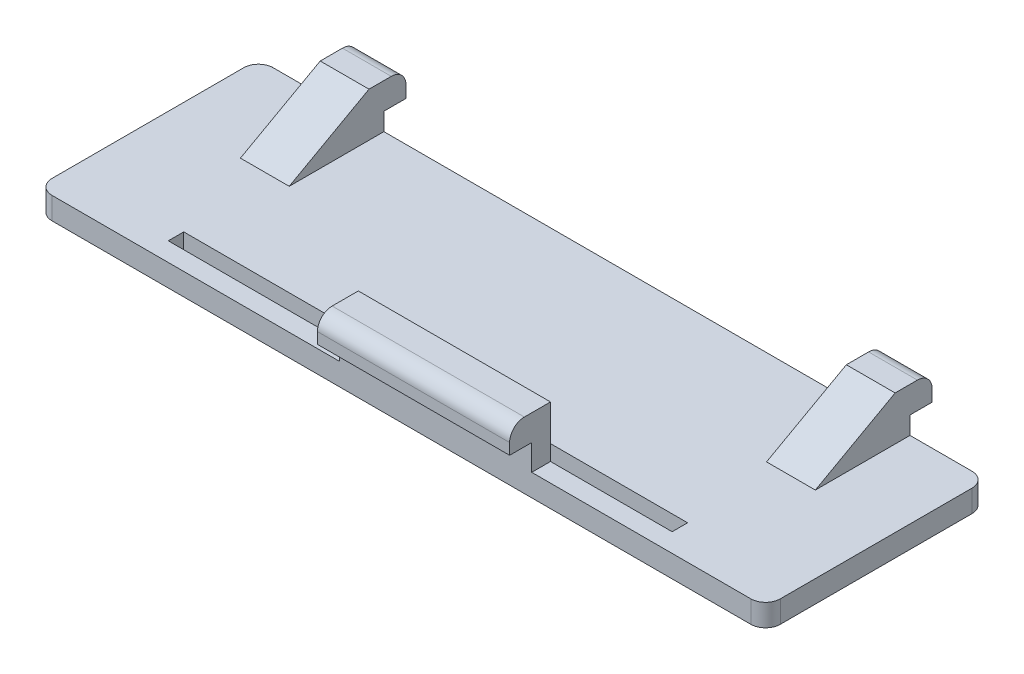
from build123d import *
from OCP.BRepFilletAPI import BRepFilletAPI_MakeChamfer

# Parameters (mm, degrees)
SKETCH1_W                 = 5
SKETCH1_H                 = 1.629773482
SKETCH1_H_2               = 1.605700765
BOSS_EXTRUDE21_DEPTH      = 1.5
BOSS_EXTRUDE22_DEPTH      = 0.0001
BOSS_EXTRUDE22_DEPTH_BACK = 5
SKETCH4_W                 = 13.038345926
SKETCH4_H                 = 1.27322458
SKETCH5_W                 = 13.038345926
SKETCH5_H                 = 1.75
BOSS_EXTRUDE23_DEPTH      = 1.5
SKETCH6_W                 = 3.309716912
SKETCH6_H                 = 6.42211522
SKETCH6_W_2               = 3.309716913
BOSS_EXTRUDE24_DEPTH      = 3
SKETCH8_W                 = 3.309716912
SKETCH8_H                 = 1.8
SKETCH8_W_2               = 3.309716913
BOSS_EXTRUDE26_DEPTH      = 1.5
FILLET1_R                 = 1
FILLET2_R                 = 1
CHAMFER1_SIZE             = 3
CHAMFER1_SIZE_2           = 5.412143266


with BuildPart() as part:
    # Sketch1 → Boss-Extrude21 (new body)
    # profile 1 of 3: a face of its own
    with BuildSketch(Plane(origin=(0, 0, 0), x_dir=(1, 0, 0), z_dir=(0, 1, 0))):
        with Locations((9.977336143, 2.209185976)):
            Rectangle(SKETCH1_W, SKETCH1_H)
    # profile 2 of 3: a face of its own
    with BuildSketch(Plane(origin=(0, 0, 0), x_dir=(1, 0, 0), z_dir=(0, 1, 0))):
        Polygon((-7.422672964, -10.702702703), (-20.313450574, -10.702702703), (-20.313450574, -9.652730884), (13.867336143, -9.652730884), (13.867336143, -10.702702703), (0.977336143, -10.702702703), (0.977336143, -11.975927283), (21.477336143, -11.975927283), (21.477336143, 3.024072717), (12.477336143, 3.024072717), (12.477336143, 1.394299235), (7.477336143, 1.394299235), (7.477336143, 3.024072717), (-27.922663857, 3.024072717), (-27.922663857, -11.975927283), (-7.422672964, -11.975927283), align=None)
        with Locations((-16.422663857, 2.186483824)):
            Rectangle(SKETCH1_W, SKETCH1_H_2, mode=Mode.SUBTRACT)
    # profile 3 of 3: a face of its own
    with BuildSketch(Plane(origin=(0, 0, 0), x_dir=(1, 0, 0), z_dir=(0, 1, 0))):
        with Locations((-16.422663857, 2.186483824)):
            Rectangle(SKETCH1_W, SKETCH1_H_2)
    extrude(amount=BOSS_EXTRUDE21_DEPTH)

    # Sketch4 → Boss-Extrude22 (add, two sides: drawn at the far end of the back side and taken through both)
    with BuildSketch(Plane.XZ.offset(-BOSS_EXTRUDE22_DEPTH_BACK)):
        with Locations((-0.903500001, 11.339314993)):
            Rectangle(SKETCH4_W, SKETCH4_H)
    extrude(amount=BOSS_EXTRUDE22_DEPTH + BOSS_EXTRUDE22_DEPTH_BACK)

    # Sketch5 → Boss-Extrude23 (add)
    with BuildSketch(Plane.XY.offset(11.975927283)):
        with Locations((-0.903500001, 4.125)):
            Rectangle(SKETCH5_W, SKETCH5_H)
    extrude(amount=BOSS_EXTRUDE23_DEPTH)

    # Sketch6 → Boss-Extrude24 (add)
    with BuildSketch(Plane(origin=(0, 1.5, 0), x_dir=(1, 0, 0), z_dir=(0, 1, 0))):
        with Locations((14.622477687, -0.186984893)):
            Rectangle(SKETCH6_W, SKETCH6_H)
        with Locations((-21.0678054, -0.186984893)):
            Rectangle(SKETCH6_W_2, SKETCH6_H)
    extrude(amount=BOSS_EXTRUDE24_DEPTH)

    # Sketch8 → Boss-Extrude26 (add)
    with BuildSketch(Plane(origin=(0, 0, -3.024072717), x_dir=(-1, 0, 0), z_dir=(0, 0, -1))):
        with Locations((-14.622477687, 3.6)):
            Rectangle(SKETCH8_W, SKETCH8_H)
        with Locations((21.0678054, 3.6)):
            Rectangle(SKETCH8_W_2, SKETCH8_H)
    extrude(amount=BOSS_EXTRUDE26_DEPTH)

    # Fillet1
    fillet1_edges = [part.edges().sort_by_distance(p)[0] for p in [
        (14.622477687, 4.5, -4.524072717),
        (-21.0678054, 4.5, -4.524072717),
        (-0.903500001, 5, 13.475927283),
    ]]
    fillet(fillet1_edges, radius=FILLET1_R)

    # Fillet2
    fillet2_edges = [part.edges().sort_by_distance(p)[0] for p in [
        (21.477336143, 0.75, 11.975927283),
        (-27.922663857, 0.75, 11.975927283),
        (-27.922663857, 0.75, -3.024072717),
        (21.477336143, 0.75, -3.024072717),
    ]]
    fillet(fillet2_edges, radius=FILLET2_R)

    # Chamfer1
    chamfer1_edges_1 = [part.edges().sort_by_distance(p)[0] for p in [
        (14.622477687, 4.5, 3.398042503),
    ]]
    chamfer1_side_1 = [part.faces().sort_by_distance(p)[0] for p in [
        (14.622477687, 4.44, 3.398042503),
    ]]
    chamfer1_edges_2 = [part.edges().sort_by_distance(p)[0] for p in [
        (-21.0678054, 4.5, 3.398042503),
    ]]
    chamfer1_side_2 = [part.faces().sort_by_distance(p)[0] for p in [
        (-21.0678054, 4.44, 3.398042503),
    ]]
    chamfer1 = BRepFilletAPI_MakeChamfer(part.part.solid().wrapped)
    for e in chamfer1_edges_1:
        chamfer1.Add(CHAMFER1_SIZE - 0.0001, CHAMFER1_SIZE_2 - 0.0001, e.wrapped, chamfer1_side_1[0].wrapped)
    for e in chamfer1_edges_2:
        chamfer1.Add(CHAMFER1_SIZE - 0.0001, CHAMFER1_SIZE_2 - 0.0001, e.wrapped, chamfer1_side_2[0].wrapped)
    add(Compound.cast(chamfer1.Shape()), mode=Mode.REPLACE)  # a hair under: the kernel refuses the full size


solid = part.part
